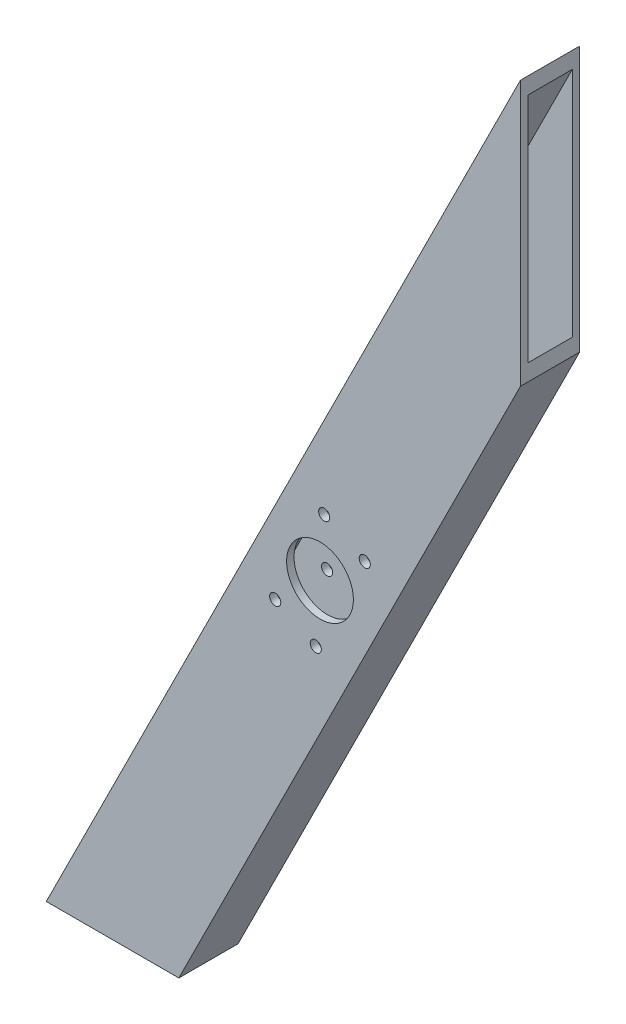
from build123d import *

# Parameters (mm, degrees)
BOSS_EXTRUDE1_DEPTH = 25.4
SHELL1_T            = -3.175
SKETCH2_R           = 14.3129
CUT_EXTRUDE1_DEPTH  = 456.078410826
SKETCH3_R           = 2.38125
CUT_EXTRUDE2_DEPTH  = 456.078410826


with BuildPart() as part:
    # Sketch1 → Boss-Extrude1 (new body)
    with BuildSketch(Plane.XY):
        Polygon((0, 0), (203.2, 406.4), (203.2, 292.807746743), (56.796126628, 0), align=None)
    extrude(amount=BOSS_EXTRUDE1_DEPTH)

    # Shell1
    shell1_openings = [part.faces().sort_by_distance(p)[0] for p in [
        (203.2, 349.603873372, 12.7),
        (28.398063314, 0, 12.7),
    ]]
    offset(amount=SHELL1_T, openings=shell1_openings, kind=Kind.INTERSECTION)

    # Sketch2 → Cut-Extrude1 (cut, through all)
    with BuildSketch(Plane.XY.offset(25.4)):
        with Locations((117.298063314, 177.8)):
            Circle(SKETCH2_R)
    extrude(amount=-CUT_EXTRUDE1_DEPTH, mode=Mode.SUBTRACT)

    # Sketch3 → Cut-Extrude2 (cut, through all)
    with BuildSketch(Plane.XY.offset(25.4)):
        with Locations((136.486593771, 194.442124231)):
            Circle(SKETCH3_R)
        with Locations((115.497482204, 152.463901096)):
            Circle(SKETCH3_R)
        with Locations((98.109532857, 161.157875769)):
            Circle(SKETCH3_R)
        with Locations((119.098644425, 203.136098904)):
            Circle(SKETCH3_R)
    extrude(amount=-CUT_EXTRUDE2_DEPTH, mode=Mode.SUBTRACT)


solid = part.part
